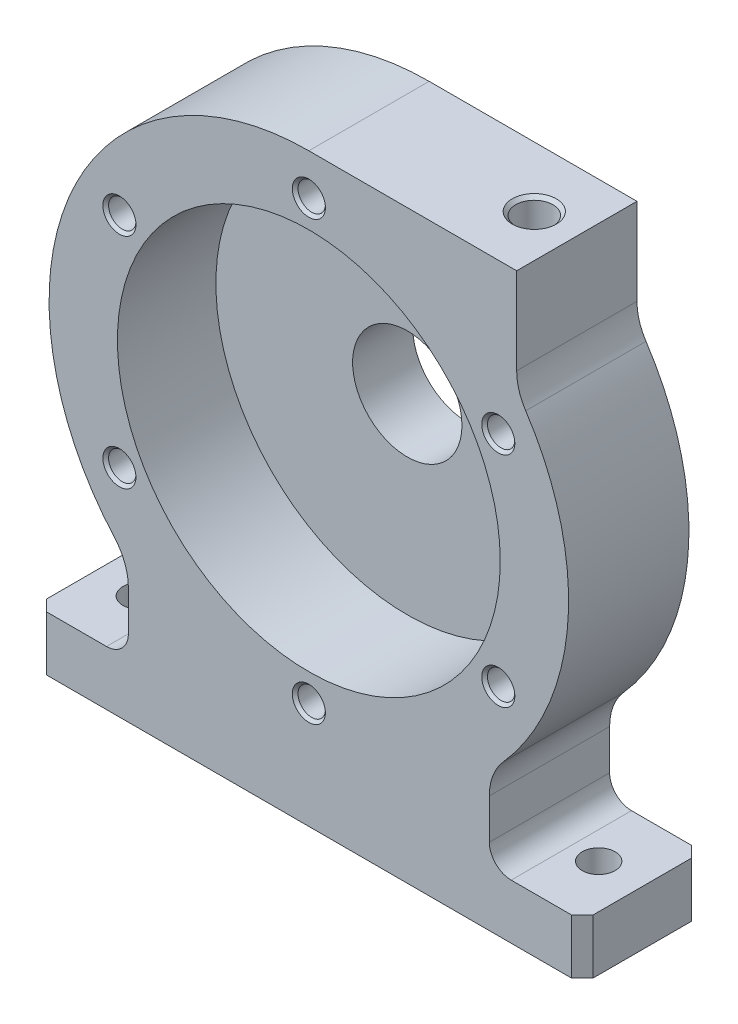
from build123d import *

# Parameters (mm, degrees)
BOSS_EXTRUDE1_DEPTH                                 = 11
SKETCH2_R                                           = 35
CUT_EXTRUDE1_DEPTH                                  = 18
SKETCH4_R                                           = 14
SKETCH4_R_2                                         = 10
BOSS_EXTRUDE2_DEPTH                                 = 7
SKETCH5_R                                           = 10
CUT_EXTRUDE2_DEPTH                                  = 81.77282959
FILLET1_R                                           = 4
CHAMFER1_SIZE                                       = 2
M8X1_25_TAPPED_HOLE1_D                              = 6.8
M8X1_25_TAPPED_HOLE1_DEPTH                          = 29.75
M8X1_25_TAPPED_HOLE1_CSINK_D                        = 8.05
M8X1_25_TAPPED_HOLE1_CSINK_ANGLE                    = 90
M8X1_25_TAPPED_HOLE1_TIP                            = 2.042926105
CIRPATTERN1_COUNT                                   = 6
CSK_FOR_M8_COUNTERSUNK_FLAT_HEAD_SCREW1_D           = 6
CSK_FOR_M8_COUNTERSUNK_FLAT_HEAD_SCREW1_DEPTH       = 20
CSK_FOR_M8_COUNTERSUNK_FLAT_HEAD_SCREW1_CSINK_D     = 8
CSK_FOR_M8_COUNTERSUNK_FLAT_HEAD_SCREW1_CSINK_ANGLE = 90
CSK_FOR_M8_COUNTERSUNK_FLAT_HEAD_SCREW1_TIP         = 1.802581857


with BuildPart() as part:
    # Sketch1 → Boss-Extrude1 (new, symmetric)
    with BuildSketch(Plane.XY):
        with BuildLine():
            Line((0, 47.5), (38, 47.5))
            Line((38, 47.5), (38, 31.658332237))
            ThreePointArc((38, 31.658332237), (38.421945373, 28.784159388), (39.652173913, 26.152535326))
            ThreePointArc((39.652173913, 26.152535326), (47.378709914, -3.392321751), (35.52173913, -31.534997212))
            ThreePointArc((35.52173913, -31.534997212), (33.651668366, -34.623071473), (33, -38.173943993))
            Line((33, -38.173943993), (33, -45.5))
            ThreePointArc((33, -45.5), (34.171572875, -48.328427125), (37, -49.5))
            Line((37, -49.5), (50, -49.5))
            Line((50, -49.5), (50, -59.5))
            Line((50, -59.5), (-50, -59.5))
            Line((-50, -59.5), (-50, -49.5))
            Line((-50, -49.5), (-37, -49.5))
            ThreePointArc((-37, -49.5), (-34.171572875, -48.328427125), (-33, -45.5))
            Line((-33, -45.5), (-33, -38.173943993))
            ThreePointArc((-33, -38.173943993), (-33.651668366, -34.623071473), (-35.52173913, -31.534997212))
            ThreePointArc((-35.52173913, -31.534997212), (-43.325294965, 19.472257605), (0, 47.5))
        make_face()
    extrude(amount=BOSS_EXTRUDE1_DEPTH, both=True)

    # Sketch2 → Cut-Extrude1 (cut)
    with BuildSketch(Plane.XY.offset(11)):
        Circle(SKETCH2_R)
    extrude(amount=-CUT_EXTRUDE1_DEPTH, mode=Mode.SUBTRACT)

    # Sketch4 → Boss-Extrude2 (add)
    with BuildSketch(Plane(origin=(0, 0, -11), x_dir=(-1, 0, 0), z_dir=(0, 0, -1))):
        Circle(SKETCH4_R)
        Circle(SKETCH4_R_2, mode=Mode.SUBTRACT)
    extrude(amount=BOSS_EXTRUDE2_DEPTH)

    # Sketch5 → Cut-Extrude2 (cut, through all)
    with BuildSketch(Plane(origin=(0, 0, -11), x_dir=(-1, 0, 0), z_dir=(0, 0, -1))):
        Circle(SKETCH5_R)
    extrude(amount=-CUT_EXTRUDE2_DEPTH, mode=Mode.SUBTRACT)

    # Fillet1
    fillet1_edges = [part.edges().sort_by_distance(p)[0] for p in [
        (14, 0, -11),
    ]]
    fillet(fillet1_edges, radius=FILLET1_R)

    # Chamfer1
    chamfer1_edges = [part.edges().sort_by_distance(p)[0] for p in [
        (50, -54.5, -11),
        (50, -54.5, 11),
        (-50, -54.5, -11),
        (-50, -54.5, 11),
    ]]
    chamfer(chamfer1_edges, length=CHAMFER1_SIZE)

    # M8x1.25 Tapped Hole1
    with Locations(Plane(origin=(0, 47.5, 0), x_dir=(1, 0, 0), z_dir=(0, 1, 0))):
        with Locations((30.22415, 0)):
            CounterSinkHole(M8X1_25_TAPPED_HOLE1_D / 2, M8X1_25_TAPPED_HOLE1_CSINK_D / 2, depth=M8X1_25_TAPPED_HOLE1_DEPTH, counter_sink_angle=M8X1_25_TAPPED_HOLE1_CSINK_ANGLE)
            with Locations((0, 0, -(M8X1_25_TAPPED_HOLE1_DEPTH + M8X1_25_TAPPED_HOLE1_TIP / 2))):  # 118° drill point
                Cone(0, M8X1_25_TAPPED_HOLE1_D / 2, M8X1_25_TAPPED_HOLE1_TIP, mode=Mode.SUBTRACT)

    # Sketch11 → M6x1.0 Tapped Hole1 (revolve, cut)
    with BuildSketch(Plane(origin=(0, 40, 11), x_dir=(0, -1, 0), z_dir=(1, 0, 0))):
        Polygon((0, 0), (0, 16.502151548), (2.5, 15), (2.5, 0.525), (3.025, 0), align=None)
    m6x1_0_tapped_hole1 = revolve(axis=Axis((0, 40, 17.35), (0, 0, -1)), mode=Mode.SUBTRACT)

    # CirPattern1: M6x1.0 Tapped Hole1 ×6 about axis
    cirpattern1_axis = Axis((0, 0, -7), (0, 0, 1))
    for i in range(1, CIRPATTERN1_COUNT):
        add(m6x1_0_tapped_hole1.rotate(cirpattern1_axis, i * 360 / CIRPATTERN1_COUNT), mode=Mode.SUBTRACT)

    # CSK for M8 Countersunk Flat Head Screw1
    with Locations(Plane(origin=(0, -59.5, 0), x_dir=(-1, 0, 0), z_dir=(0, -1, 0))):
        with Locations((-42, 0), (42, 0)):
            CounterSinkHole(CSK_FOR_M8_COUNTERSUNK_FLAT_HEAD_SCREW1_D / 2, CSK_FOR_M8_COUNTERSUNK_FLAT_HEAD_SCREW1_CSINK_D / 2, depth=CSK_FOR_M8_COUNTERSUNK_FLAT_HEAD_SCREW1_DEPTH, counter_sink_angle=CSK_FOR_M8_COUNTERSUNK_FLAT_HEAD_SCREW1_CSINK_ANGLE)
            with Locations((0, 0, -(CSK_FOR_M8_COUNTERSUNK_FLAT_HEAD_SCREW1_DEPTH + CSK_FOR_M8_COUNTERSUNK_FLAT_HEAD_SCREW1_TIP / 2))):  # 118° drill point
                Cone(0, CSK_FOR_M8_COUNTERSUNK_FLAT_HEAD_SCREW1_D / 2, CSK_FOR_M8_COUNTERSUNK_FLAT_HEAD_SCREW1_TIP, mode=Mode.SUBTRACT)


solid = part.part
